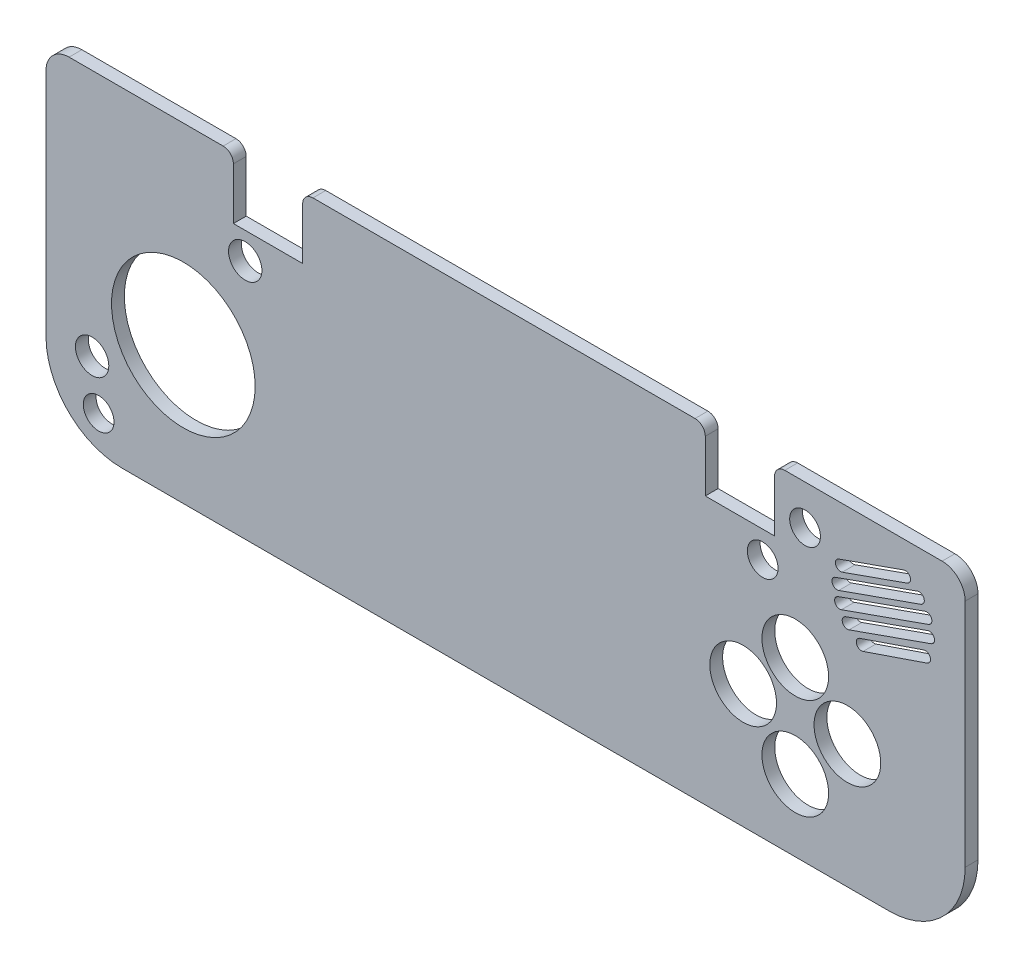
from build123d import *

# Parameters (mm, degrees)
BOSS_EXTRU_1_DEPTH       = 2.5
ESQUISSE22_R             = 14
ENL_V_MAT_EXTRU_1_DEPTH  = 2.5
ESQUISSE23_R             = 3.25
ENL_V_MAT_EXTRU_2_DEPTH  = 2.5
ESQUISSE24_W             = 13.5
ESQUISSE24_H             = 8.72
ENL_V_MAT_EXTRU_3_DEPTH  = 2.5
ESQUISSE25_W             = 13.5
ESQUISSE25_H             = 3.371774097
ENL_V_MAT_EXTRU_4_DEPTH  = 2.5
CONG_1_R                 = 2
ESQUISSE26_R             = 6.5
ENL_V_MAT_EXTRU_5_DEPTH  = 2.5
ESQUISSE27_R             = 6.5
ENL_V_MAT_EXTRU_6_DEPTH  = 2.5
ESQUISSE30_W             = 13.5
ESQUISSE30_H             = 12.08
ENL_V_MAT_EXTRU_7_DEPTH  = 2.5
CONG_2_R                 = 2
ESQUISSE31_R             = 3
ENL_V_MAT_EXTRU_8_DEPTH  = 2.5
ENL_V_MAT_EXTRU_9_DEPTH  = 2.5
ESQUISSE33_R             = 3.25
ENL_V_MAT_EXTRU_10_DEPTH = 10
ESQUISSE34_R             = 3
ENL_V_MAT_EXTRU_11_DEPTH = 10


with BuildPart() as part:
    # Esquisse20 → Boss.-Extru.1 (new body)
    with BuildSketch(Plane.XY):
        with BuildLine():
            Line((14.8, -2), (164.37, -2))
            ThreePointArc((164.37, -2), (174.835180362, 2.334819638), (179.17, 12.8))
            Line((179.17, 12.8), (179.17, 57.73))
            ThreePointArc((179.17, 57.73), (177.851980515, 60.911980515), (174.67, 62.23))
            Line((174.67, 62.23), (4.5, 62.23))
            ThreePointArc((4.5, 62.23), (1.318019485, 60.911980515), (0, 57.73))
            Line((0, 57.73), (0, 12.8))
            ThreePointArc((0, 12.8), (4.334819638, 2.334819638), (14.8, -2))
        make_face()
    extrude(amount=BOSS_EXTRU_1_DEPTH)

    # Esquisse22 → Enlèv. mat.-Extru.1 (cut)
    with BuildSketch(Plane.XY.offset(2.5)):
        with Locations((26.77, 24.77)):
            Circle(ESQUISSE22_R)
    extrude(amount=-ENL_V_MAT_EXTRU_1_DEPTH, mode=Mode.SUBTRACT)

    # Esquisse23 → Enlèv. mat.-Extru.2 (cut)
    with BuildSketch(Plane.XY.offset(2.5)):
        with Locations((8.99, 13.97)):
            Circle(ESQUISSE23_R)
        with Locations((-24.978214815, 23.569105699)):
            Circle(ESQUISSE23_R)
    extrude(amount=-ENL_V_MAT_EXTRU_2_DEPTH, mode=Mode.SUBTRACT)

    # Esquisse24 → Enlèv. mat.-Extru.3 (cut)
    with BuildSketch(Plane.XY.offset(2.5)):
        with Locations((43.28, 54.51)):
            Rectangle(ESQUISSE24_W, ESQUISSE24_H)
    extrude(amount=-ENL_V_MAT_EXTRU_3_DEPTH, mode=Mode.SUBTRACT)

    # Esquisse25 → Enlèv. mat.-Extru.4 (cut)
    with BuildSketch(Plane.XY.offset(2.5)):
        with Locations((43.28, 60.555887049)):
            Rectangle(ESQUISSE25_W, ESQUISSE25_H)
    extrude(amount=-ENL_V_MAT_EXTRU_4_DEPTH, mode=Mode.SUBTRACT)

    # Congé1
    cong_1_edges = [part.edges().sort_by_distance(p)[0] for p in [
        (50.03, 62.23, 1.25),
        (36.53, 62.23, 1.25),
    ]]
    fillet(cong_1_edges, radius=CONG_1_R)

    # Esquisse26 → Enlèv. mat.-Extru.5 (cut)
    with BuildSketch(Plane.XY.offset(2.5)):
        with Locations((156.21, 22.13)):
            Circle(ESQUISSE26_R)
    extrude(amount=-ENL_V_MAT_EXTRU_5_DEPTH, mode=Mode.SUBTRACT)

    # Esquisse27 → Enlèv. mat.-Extru.6 (cut)
    with BuildSketch(Plane.XY.offset(2.5)):
        with Locations((146.05, 11.97)):
            Circle(ESQUISSE27_R)
        with Locations((135.89, 22.13)):
            Circle(ESQUISSE27_R)
        with Locations((146.05, 31.65)):
            Circle(ESQUISSE27_R)
    extrude(amount=-ENL_V_MAT_EXTRU_6_DEPTH, mode=Mode.SUBTRACT)

    # Esquisse30 → Enlèv. mat.-Extru.7 (cut)
    with BuildSketch(Plane.XY.offset(2.5)):
        with Locations((135.26, 56.19)):
            Rectangle(ESQUISSE30_W, ESQUISSE30_H)
    extrude(amount=-ENL_V_MAT_EXTRU_7_DEPTH, mode=Mode.SUBTRACT)

    # Congé2
    cong_2_edges = [part.edges().sort_by_distance(p)[0] for p in [
        (142.01, 62.23, 1.25),
        (128.51, 62.23, 1.25),
    ]]
    fillet(cong_2_edges, radius=CONG_2_R)

    # Esquisse31 → Enlèv. mat.-Extru.8 (cut)
    with BuildSketch(Plane.XY.offset(2.5)):
        with Locations((147.96, 54.51)):
            Circle(ESQUISSE31_R)
        with Locations((139.7, 44.99)):
            Circle(ESQUISSE31_R)
    extrude(amount=-ENL_V_MAT_EXTRU_8_DEPTH, mode=Mode.SUBTRACT)

    # Esquisse32 → Enlèv. mat.-Extru.9 (cut)
    with BuildSketch(Plane.XY.offset(2.5)):
        with BuildLine():
            Line((172.018614708, 50.217190958), (155.048051959, 44.217190958))
            ThreePointArc((155.048051959, 44.217190958), (153.771909584, 44.826666667), (154.381385292, 46.102809042))
            Line((154.381385292, 46.102809042), (171.351948041, 52.102809042))
            ThreePointArc((171.351948041, 52.102809042), (172.628090416, 51.493333333), (172.018614708, 50.217190958))
        make_face()
        with BuildLine():
            Line((153.866666667, 49.102809042), (169.866666667, 54.759663291))
            ThreePointArc((169.866666667, 54.759663291), (171.142809042, 54.150187583), (170.533333333, 52.874045208))
            Line((170.533333333, 52.874045208), (154.533333333, 47.217190958))
            ThreePointArc((154.533333333, 47.217190958), (153.257190958, 47.826666667), (153.866666667, 49.102809042))
        make_face()
        with BuildLine():
            Line((154.542111346, 52.523595314), (167.191221987, 56.995731269))
            ThreePointArc((167.191221987, 56.995731269), (168.467364362, 56.38625556), (167.857888654, 55.110113185))
            Line((167.857888654, 55.110113185), (155.208778013, 50.63797723))
            ThreePointArc((155.208778013, 50.63797723), (153.932635638, 51.247452939), (154.542111346, 52.523595314))
        make_face()
        with BuildLine():
            Line((155.866666667, 43.445954792), (171.866666667, 49.102809042))
            ThreePointArc((171.866666667, 49.102809042), (173.142809042, 48.493333333), (172.533333333, 47.217190958))
            Line((172.533333333, 47.217190958), (156.533333333, 41.560336709))
            ThreePointArc((156.533333333, 41.560336709), (155.257190958, 42.169812417), (155.866666667, 43.445954792))
        make_face()
        with BuildLine():
            Line((158.617948097, 41.177385778), (171.09857492, 45.446217537))
            ThreePointArc((171.09857492, 45.446217537), (172.368388344, 44.823663229), (171.745834035, 43.553849804))
            Line((171.745834035, 43.553849804), (159.265207213, 39.285018045))
            ThreePointArc((159.265207213, 39.285018045), (157.995393788, 39.907572354), (158.617948097, 41.177385778))
        make_face()
    extrude(amount=-ENL_V_MAT_EXTRU_9_DEPTH, mode=Mode.SUBTRACT)

    # Esquisse33 → Enlèv. mat.-Extru.10 (cut)
    with BuildSketch(Plane.XY.offset(2.5)):
        with Locations((38.83, 44.99)):
            Circle(ESQUISSE33_R)
    extrude(amount=-ENL_V_MAT_EXTRU_10_DEPTH, mode=Mode.SUBTRACT)

    # Esquisse34 → Enlèv. mat.-Extru.11 (cut)
    with BuildSketch(Plane.XY.offset(2.5)):
        with Locations((10.26, 4.99)):
            Circle(ESQUISSE34_R)
    extrude(amount=-ENL_V_MAT_EXTRU_11_DEPTH, mode=Mode.SUBTRACT)


solid = part.part
